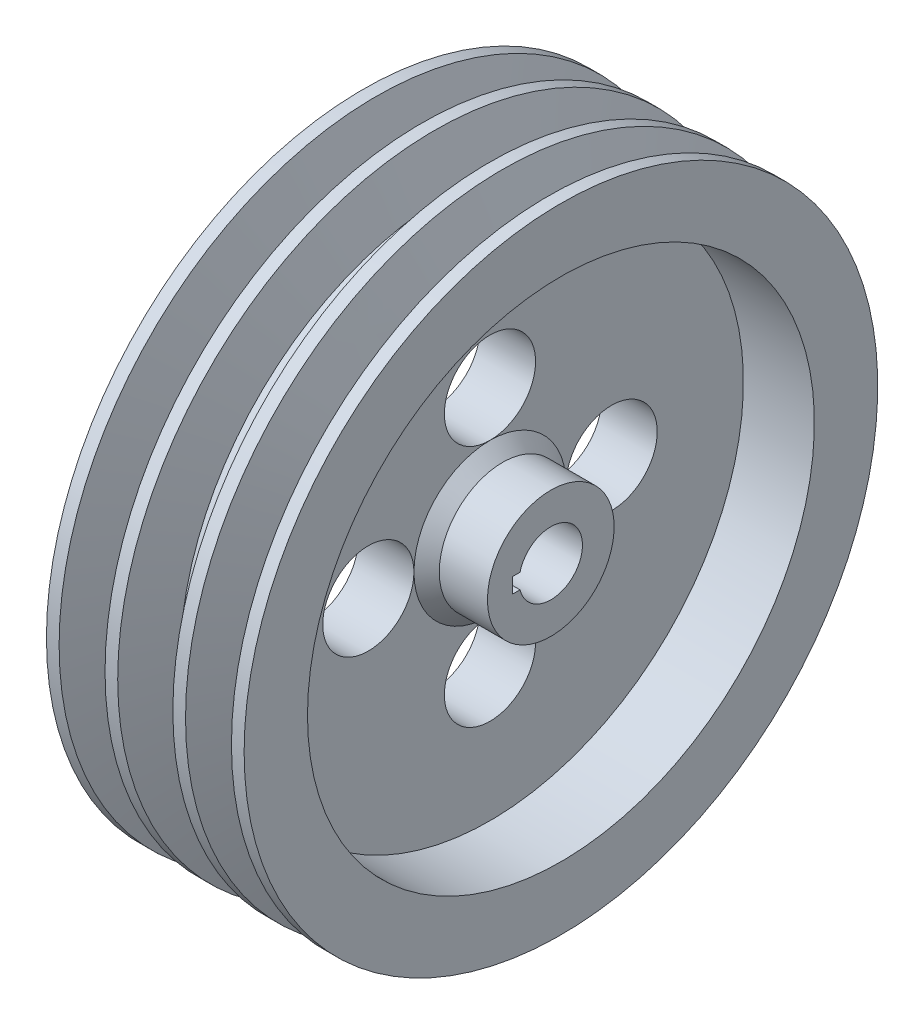
from build123d import *

# Parameters (mm, degrees)
CUT_EXTRUDE1_DEPTH      = 184.711730709
CUT_EXTRUDE1_DEPTH_BACK = 184.711730709
SKETCH2_R               = 18
CUT_EXTRUDE2_DEPTH      = 192.64028804


with BuildPart() as part:
    # Sketch1 → Revolve9 (revolve)
    with BuildSketch(Plane.XY):
        with BuildLine():
            Line((35, 25), (16, 25))
            Line((16, 25), (11, 30))
            Line((11, 30), (11, 39.286537664))
            Line((11, 39.286537664), (11, 75.286537664))
            Line((11, 75.286537664), (11, 100))
            Line((11, 100), (39, 100))
            Line((39, 100), (39, 125))
            Line((39, 125), (34, 125))
            Line((34, 125), (28.132684284, 107))
            Line((28.132684284, 107), (23.132684284, 107))
            Line((23.132684284, 107), (15.879938391, 125))
            Line((15.879938391, 125), (10.879938391, 125))
            Line((10.879938391, 125), (4.328474174, 107))
            Line((4.328474174, 107), (-4.328474174, 107))
            Line((-4.328474174, 107), (-10.879938391, 125))
            Line((-10.879938391, 125), (-15.879938391, 125))
            Line((-15.879938391, 125), (-23.132684284, 107))
            Line((-23.132684284, 107), (-28.132684284, 107))
            Line((-28.132684284, 107), (-34, 125))
            Line((-34, 125), (-39, 125))
            Line((-39, 125), (-39, 100))
            Line((-39, 100), (-11, 100))
            Line((-11, 100), (-11, 75.286537664))
            Line((-11, 75.286537664), (-11, 39.286537664))
            Line((-11, 39.286537664), (-11, 30))
            Line((-11, 30), (-16, 25))
            Line((-16, 25), (-30, 25))
            ThreePointArc((-30, 25), (-33.535533906, 23.535533906), (-35, 20))
            Line((-35, 20), (-35, 12.5))
            Line((-35, 12.5), (35, 12.5))
            Line((35, 12.5), (35, 25))
        make_face()
    revolve(axis=Axis((-68.914082631, 0, 0), (1, 0, 0)))

    # Sketch2 → Cut-Extrude1 (cut, two sides: drawn at the far end of the back side and taken through both)
    with BuildSketch(Plane.ZY.offset(11).offset(-CUT_EXTRUDE1_DEPTH_BACK)):
        with Locations((0, 48)):
            Circle(SKETCH2_R)
        with Locations((48, 0)):
            Circle(SKETCH2_R)
        with Locations((0, -48)):
            Circle(SKETCH2_R)
        with Locations((-48, 0)):
            Circle(SKETCH2_R)
    extrude(amount=CUT_EXTRUDE1_DEPTH + CUT_EXTRUDE1_DEPTH_BACK, mode=Mode.SUBTRACT)

    # Sketch3 → Cut-Extrude2 (cut, through all)
    with BuildSketch(Plane.ZY.offset(35)):
        with BuildLine():
            Line((12.1346611, 3), (15.1346611, 3))
            Line((15.1346611, 3), (15.1346611, -3))
            Line((15.1346611, -3), (12.1346611, -3))
            ThreePointArc((12.1346611, -3), (-12.5, 0), (12.1346611, 3))
        make_face()
    extrude(amount=-CUT_EXTRUDE2_DEPTH, mode=Mode.SUBTRACT)


solid = part.part
